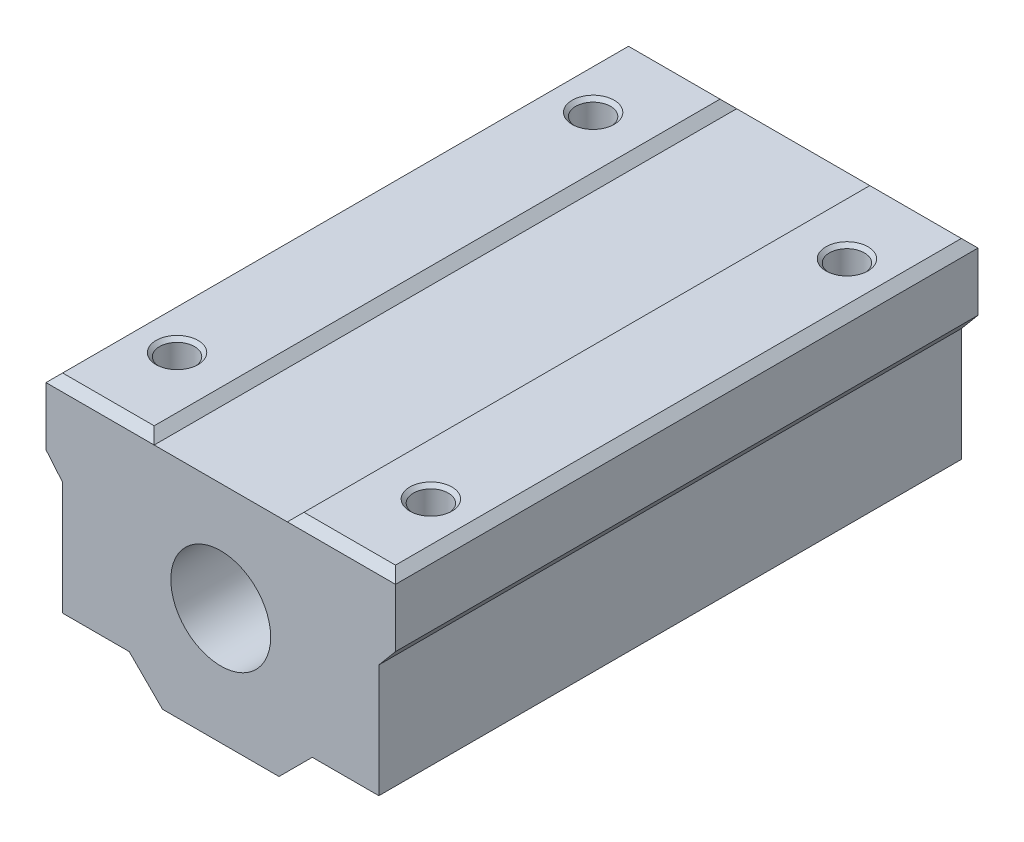
from build123d import *

# Parameters (mm, degrees)
ESBO_O1_R                       = 6
RESSALTO_EXTRUS_O1_DEPTH        = 70
CHANFRO1_SIZE                   = 1
FURO_ROSCADO_DE_M51_D           = 4.2
FURO_ROSCADO_DE_M51_CSINK_D     = 5.05
FURO_ROSCADO_DE_M51_CSINK_ANGLE = 90
CHANFRO2_SIZE                   = 1


with BuildPart() as part:
    # Esboço1 → Ressalto-extrusão1 (new body)
    with BuildSketch(Plane.XY):
        Polygon((8, 13), (-8, 13), (-8, 14), (-21, 14), (-21, 6), (-19, 3.616492815), (-19, -10), (-11, -10), (-7, -14), (7, -14), (11, -10), (19, -10), (19, 3.616492815), (21, 6), (21, 14), (8, 14), align=None)
        Circle(ESBO_O1_R, mode=Mode.SUBTRACT)
    extrude(amount=-RESSALTO_EXTRUS_O1_DEPTH)

    # Chanfro1
    chanfro1_edges = [part.edges().sort_by_distance(p)[0] for p in [
        (14.5, 14, -70),
        (21, 14, -35),
        (14.5, 14, 0),
        (8, 14, -35),
        (-14.5, 14, -70),
        (-21, 14, -35),
        (-14.5, 14, 0),
        (-8, 14, -35),
    ]]
    chamfer(chanfro1_edges, length=CHANFRO1_SIZE - 0.0001)  # a hair under: the kernel refuses the full size

    # Furo roscado de M51 (through all)
    with Locations(Plane(origin=(0, 14, 0), x_dir=(1, 0, 0), z_dir=(0, 1, 0))):
        with Locations((15.25, 10), (15.25, 60), (-15.25, 60), (-15.25, 10)):
            CounterSinkHole(FURO_ROSCADO_DE_M51_D / 2, FURO_ROSCADO_DE_M51_CSINK_D / 2, counter_sink_angle=FURO_ROSCADO_DE_M51_CSINK_ANGLE)

    # Chanfro2
    chanfro2_edges = [part.edges().sort_by_distance(p)[0] for p in [
        (-13.15, -10, -10),
        (-13.15, -10, -60),
        (17.35, -10, -60),
        (17.35, -10, -10),
    ]]
    chamfer(chanfro2_edges, length=CHANFRO2_SIZE)


solid = part.part
